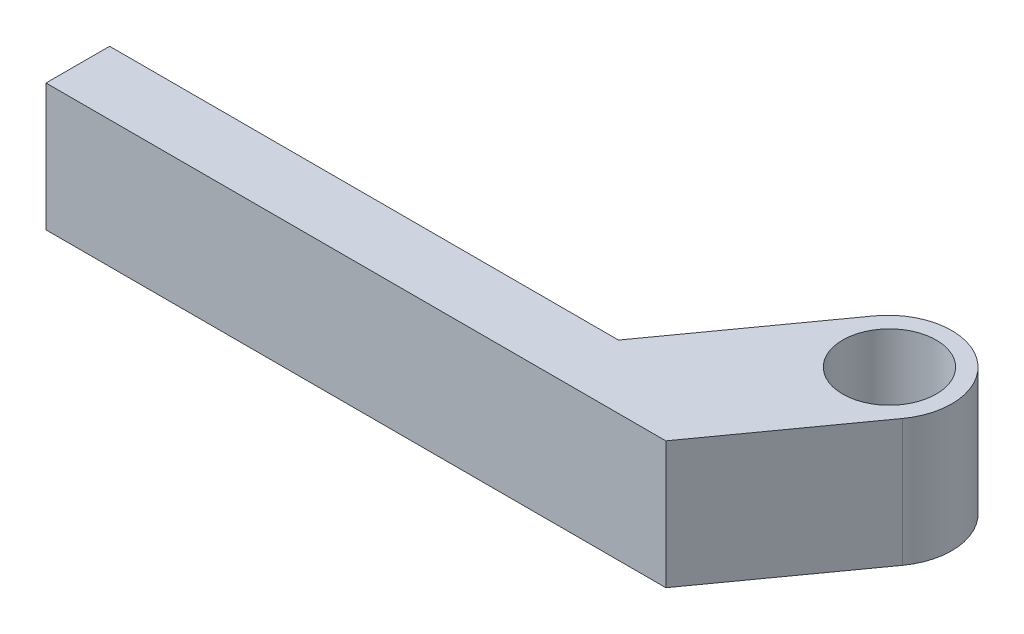
from build123d import *

# Parameters (mm, degrees)
BOSS_EXTRUDE1_DEPTH      = 12.7
U_0_368_DIAMETER_HOLE1_D = 9.3472


with BuildPart() as part:
    # Sketch2 → Boss-Extrude1 (new body)
    with BuildSketch(Plane(origin=(0, 0, 0), x_dir=(1, 0, 0), z_dir=(0, 1, 0))):
        with BuildLine():
            Line((-10.638933845, -35.242978242), (0.0062465, -20.425508427))
            ThreePointArc((0.0062465, -20.425508427), (8.868318086, -18.973376472), (10.320450041, -27.835448057))
            Line((10.320450041, -27.835448057), (0.436752504, -41.592978242))
            Line((0.436752504, -41.592978242), (-10.638933845, -41.592978242))
            Line((-10.638933845, -41.592978242), (-61.438933845, -41.592978242))
            Line((-61.438933845, -41.592978242), (-61.438933845, -35.242978242))
            Line((-61.438933845, -35.242978242), (-10.638933845, -35.242978242))
        make_face()
    extrude(amount=BOSS_EXTRUDE1_DEPTH)

    # U (0.368) Diameter Hole1 (through all)
    with Locations(Plane(origin=(0, 12.7, 0), x_dir=(1, 0, 0), z_dir=(0, 1, 0))):
        with Locations((5.218739795, -24.053376472)):
            Hole(U_0_368_DIAMETER_HOLE1_D / 2)


solid = part.part
